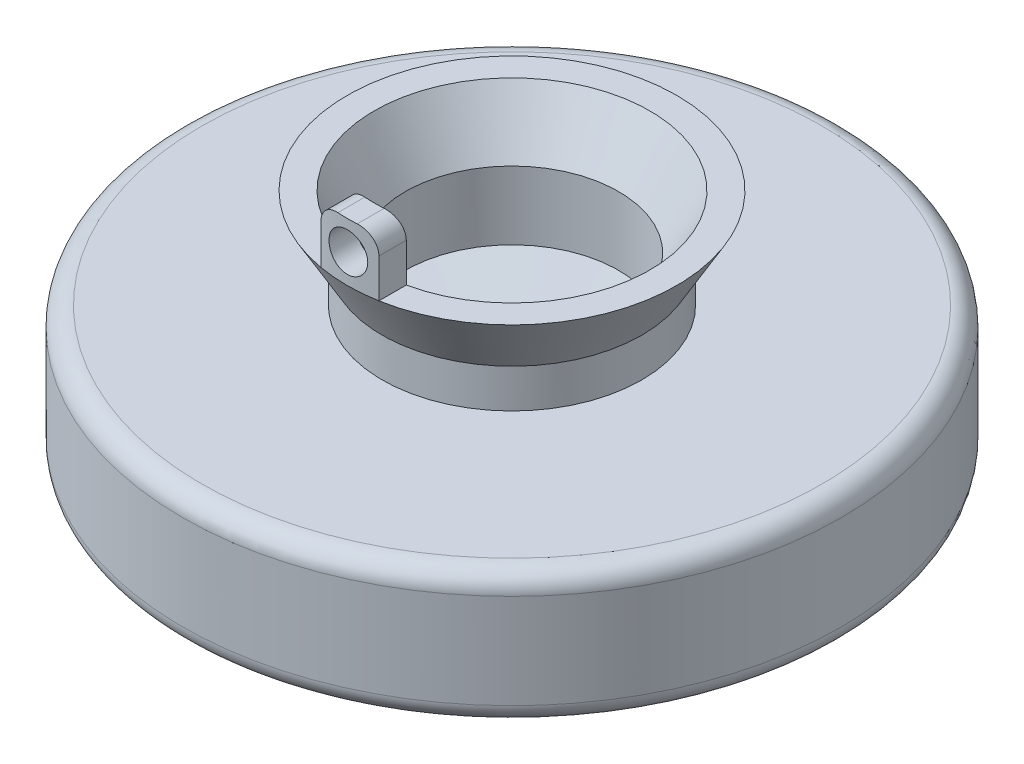
from build123d import *
from build123d.topology import SkipClean

# Parameters (mm, degrees)
BOSS_EXTRUDE1_REACH   = 136.289
BOSS_EXTRUDE1_START   = 10
SKETCH3_R             = 4.999999999999999
CUT_EXTRUDE1_START    = 31.588457
SKETCH5_R             = 65.44827928739575
SKETCH5_R_2           = 42.49999999994049
SKETCH5_R_3           = 35.57179676962181
CUT_EXTRUDE1_DEPTH    = 15
FILLET1_R             = 5
BODY_MOVE_COPY2_ANGLE = 135


with BuildPart() as part:
    # Sketch1 → Revolve2 (revolve)
    with BuildSketch(Plane.XY):
        with BuildLine():
            Line((78.9999999999506, -7.082815352152523), (78.9999999999506, 0))
            Line((78.9999999999506, 0), (27.5, 0))
            Line((27.5, 0), (27.499999999950607, 17.607695154586704))
            Line((27.499999999950607, 17.607695154586704), (35.57179676967505, 31.588457268119768))
            Line((35.57179676967505, 31.588457268119768), (42.4999999999506, 31.58845726811976))
            Line((42.4999999999506, 31.58845726811976), (33.4999999999506, 15.999999999999993))
            Line((33.4999999999506, 15.999999999999993), (33.49999999995061, 5.999999999999995))
            Line((33.49999999995061, 5.999999999999995), (84.99999999995062, 6))
            Line((84.99999999995062, 6), (84.99999999995062, -28.41154273188018))
            Line((84.99999999995062, -28.41154273188018), (1.684999999950615, -28.41154273188001))
            Line((1.684999999950615, -28.41154273188001), (1.684999999950614, -22.411542731880015))
            Line((1.684999999950614, -22.411542731880015), (69.78459095722907, -17.051988689483803))
            ThreePointArc((69.78459095722907, -17.051988689483803), (76.34322509430746, -13.870822807481929), (78.9999999999506, -7.082815352152523))
        make_face()
    revolve(axis=Axis((6.9172706e-10, -1021.2131135818368, 0), (-2.4e-16, 1, 0)))

    # Boss-Extrude1: up to this cone (the profile starts inside it)
    boss_extrude1_end = Plane(origin=(6.9146915e-10, 31.800589, 0), z_dir=(-2.4e-16, 1, 0)).offset(-73.82429005227355) * Cone(1e-06, 146.2057373013694, 253.23576436403738, align=(Align.CENTER, Align.CENTER, Align.MIN), mode=Mode.PRIVATE)
    # Sketch3 → Boss-Extrude1 (add, up to the surface)
    with BuildSketch(Plane.XY.offset(BOSS_EXTRUDE1_START), mode=Mode.PRIVATE) as boss_extrude1_sk1:
        Polygon((-7.499999999999997, 31.588457268119768), (7.499999999999997, 31.588457268119768), (7.499999999999997, 46.58845726811977), (-7.500000000000001, 46.58845726811977), align=None)
        with Locations(Location((0, 39.08845726811977, 0), (0, 0, 229.681745219))):
            Circle(SKETCH3_R, mode=Mode.SUBTRACT)
    boss_extrude1_tool1 = extrude(boss_extrude1_sk1.sketch, amount=BOSS_EXTRUDE1_REACH, mode=Mode.PRIVATE) & boss_extrude1_end
    add(boss_extrude1_tool1.solids().sort_by_distance((0, 31.800589, 10))[0])

    # Sketch5 → Cut-Extrude1 (cut)
    # profile 1 of 2: a face of its own
    with BuildSketch(Plane(origin=(0, 0, 0), x_dir=(1, 0, 0), z_dir=(0, 1, 0)).offset(CUT_EXTRUDE1_START)):
        Circle(SKETCH5_R)
        Circle(SKETCH5_R_2, mode=Mode.SUBTRACT)
    # profile 2 of 2: a face of its own
    with BuildSketch(Plane(origin=(0, 0, 0), x_dir=(1, 0, 0), z_dir=(0, 1, 0)).offset(CUT_EXTRUDE1_START)):
        Circle(SKETCH5_R_3)
    extrude(amount=CUT_EXTRUDE1_DEPTH, mode=Mode.SUBTRACT)

    # Fillet1
    fillet1_edges = [part.edges().sort_by_distance(p)[0] for p in [
        (-84.99999999856767, 5.99999999999998, -1.041e-14),
        (-84.99999999856765, -28.41154273188024, -1.041e-14),
        (-7.500000000000001, 46.58845726811977, 38.302577890655776),
        (7.499999999999997, 46.58845726811977, 38.302577890655456),
    ]]
    fillet(fillet1_edges, radius=FILLET1_R)

    # Sketch7 → Revolve5 (revolve)
    with BuildSketch(Plane(origin=(0, 0, 0), x_dir=(0, 0, -1), z_dir=(1, 0, 0))):
        Polygon((4.111825932599789, -34.90631851707844), (-4.019902051045539, -26.774590533433148), (-5.656854249492396, -28.41154273188001), (2.474873734152933, -36.5432707155253), align=None)
    revolve(axis=Axis((0, -28.41154273188001, 0), (0, -0.707106781186546, -0.707106781186549)))


with BuildPart() as body_2:
    # 5218K687 COPY: read off the stored shape, not the designer's step
    # 5218K687 COPY outline → 5218K687 COPY (revolve)
    with BuildSketch(Plane.XZ):
        with BuildLine():
            Line((1.685925, 15.2796875), (1.685925, -8.6756875))
            Line((1.685925, -8.6756875), (3.175, -8.6756875))
            Line((3.175, -8.6756875), (3.175, -7.724251387))
            ThreePointArc((3.175, -7.724251387), (3.174900403, -7.719222697), (3.174601768, -7.714201894))
            Line((3.174601768, -7.714201894), (2.813682587, -3.167404823))
            ThreePointArc((2.813682587, -3.167404823), (2.825342421, -3.13372579), (2.857993206, -3.1194375))
            Line((2.857993206, -3.1194375), (3.126881794, -3.1194375))
            ThreePointArc((3.126881794, -3.1194375), (3.159532579, -3.10514921), (3.171192413, -3.071470177))
            Line((3.171192413, -3.071470177), (2.813682587, 1.432376427))
            ThreePointArc((2.813682587, 1.432376427), (2.825342421, 1.46605546), (2.857993206, 1.48034375))
            Line((2.857993206, 1.48034375), (3.126881794, 1.48034375))
            ThreePointArc((3.126881794, 1.48034375), (3.159532579, 1.49463204), (3.171192413, 1.528311073))
            Line((3.171192413, 1.528311073), (2.813682587, 6.032157677))
            ThreePointArc((2.813682587, 6.032157677), (2.825342421, 6.06583671), (2.857993206, 6.080125))
            Line((2.857993206, 6.080125), (3.126881794, 6.080125))
            ThreePointArc((3.126881794, 6.080125), (3.159532579, 6.09441329), (3.171192413, 6.128092323))
            Line((3.171192413, 6.128092323), (2.813682587, 10.631938927))
            ThreePointArc((2.813682587, 10.631938927), (2.825342421, 10.66561796), (2.857993206, 10.67990625))
            Line((2.857993206, 10.67990625), (3.126881794, 10.67990625))
            ThreePointArc((3.126881794, 10.67990625), (3.159532579, 10.69419454), (3.171192413, 10.727873573))
            Line((3.171192413, 10.727873573), (2.819158388, 15.162736993))
            ThreePointArc((2.819158388, 15.162736993), (2.778732934, 15.245975456), (2.69255662, 15.2796875))
            Line((2.69255662, 15.2796875), (1.685925, 15.2796875))
        make_face()
    revolve(axis=Axis((0, 0, 0), (0, 0, 1)))


with BuildPart() as body_2_1:
    # Body-Move/Copy2: read off the stored shape, not the designer's step
    # Body-Move/Copy2: moved
    add(body_2.part.moved(Location((0, 20.0899945, 36.265682))).rotate(Axis((0, 0, 0), (1, 0, 0)), BODY_MOVE_COPY2_ANGLE))


with BuildPart() as part_1:
    add(part.part)

    # Combine1: union body 2
    add(body_2_1.part)

    # Chamfer1: read off the stored shape, not the designer's step
    # Chamfer1 outline → Chamfer1 (revolve)
    with SkipClean():  # the faces are left unmerged after this step: merging them gives an invalid solid
        with BuildSketch(Plane(origin=(0, -14.205771366, 14.205771366), x_dir=(1, 0, 0), z_dir=(0, -0.707106781186549, 0.707106781186546))):
            with BuildLine():
                ThreePointArc((3.175, -28.541430643), (3.174908406, -28.54625315), (3.174633755, -28.551068701))
                Line((3.174633755, -28.551068701), (4, -27.786133746))
                Line((4, -27.786133746), (4, -27.58999453))
                Line((4, -27.58999453), (3.175, -27.58999453))
                Line((3.175, -27.58999453), (3.175, -28.541430643))
            make_face()
        revolve(axis=Axis((0, -14.205771366, 14.205771366), (0, 0.707106781186546, 0.707106781186549)))

    # Sketch1<4> → Cut-Revolve1 (revolve, cut)
    with SkipClean():  # the faces are left unmerged after this step: merging them gives an invalid solid
        with BuildSketch(Plane.XY, mode=Mode.PRIVATE) as cut_revolve1_sk:
            Polygon((6.9148244e-10, -22.411542731876818), (3.4574195e-10, -28.447491482233247), (1.684999999950615, -28.41154273188001), (1.684999999950614, -22.411542731880015), align=None)
        revolve(cut_revolve1_sk.sketch.rotate(Axis((6.9172706e-10, -1021.2131135818368, 0), (-2.4e-16, 1, 0)), 180), axis=Axis((6.9172706e-10, -1021.2131135818368, 0), (-2.4e-16, 1, 0)), mode=Mode.SUBTRACT)


solid = part_1.part
